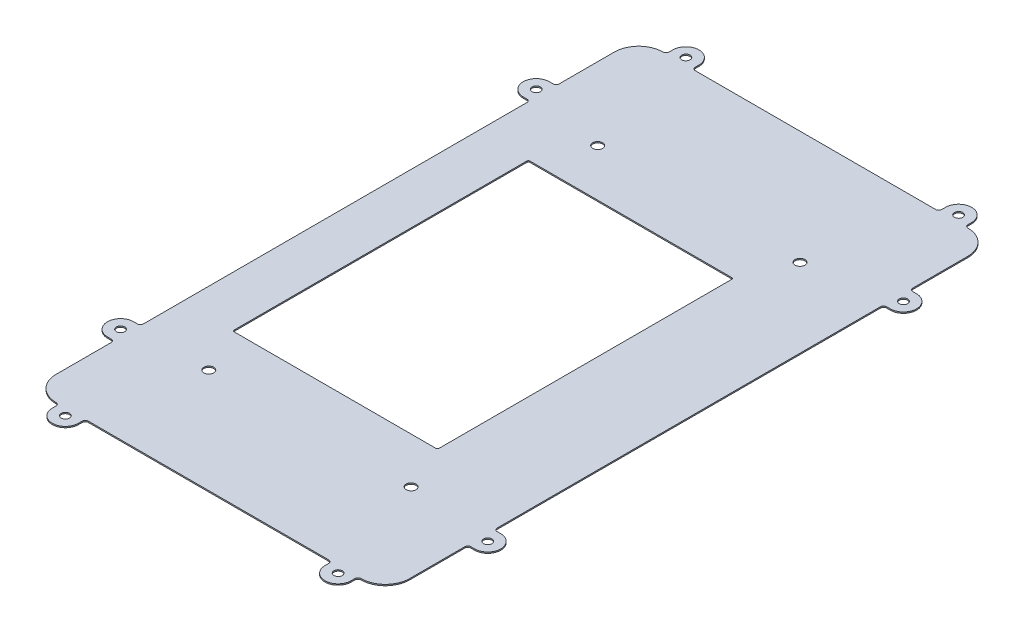
from build123d import *

# Parameters (mm, degrees)
BASE_DEPTH             = 16.1
SHELL_T                = -2
SCREEN_START           = 0.4
SCREEN_BASE_DEPTH      = 0.4
SKETCH21_R             = 1.6
LEG_HOLES_DEPTH        = 182.359773103
SCREEN_CLAMPS_DEPTH    = 0.4
SCREEN_CLAMP_FILLETS_R = 1
SKETCH23_R             = 1.35
CUT_EXTRUDE1_DEPTH     = 0.4
CUT_EXTRUDE2_DEPTH     = 191.280496373


with BuildPart() as part:
    # Sketch2 → Base (new body)
    with BuildSketch(Plane(origin=(0, 0, 0), x_dir=(1, 0, 0), z_dir=(0, 1, 0))):
        with BuildLine():
            Line((2.5, 0), (68, 0))
            ThreePointArc((68, 0), (69.767766953, 0.732233047), (70.5, 2.5))
            Line((70.5, 2.5), (70.5, 97.5))
            ThreePointArc((70.5, 97.5), (69.767766953, 99.267766953), (68, 100))
            Line((68, 100), (2.5, 100))
            ThreePointArc((2.5, 100), (0.732233047, 99.267766953), (0, 97.5))
            Line((0, 97.5), (0, 2.5))
            ThreePointArc((0, 2.5), (0.732233047, 0.732233047), (2.5, 0))
        make_face()
    extrude(amount=BASE_DEPTH)

    # Shell
    shell_openings = [part.faces().sort_by_distance(p)[0] for p in [
        (35.25, 16.1, -50),
        (35.25, 0, -50),
    ]]
    offset(amount=SHELL_T, openings=shell_openings, kind=Kind.INTERSECTION)

    # Sketch19 → Screen Base (add)
    with BuildSketch(Plane.XZ.offset(SCREEN_START)):
        with BuildLine():
            Line((-6.55, 46.74), (92.45, 46.74))
            ThreePointArc((92.45, 46.74), (98.022001436, 44.432001436), (100.33, 38.86))
            Line((100.33, 38.86), (100.33, -142.34))
            ThreePointArc((100.33, -142.34), (98.022001436, -147.912001436), (92.45, -150.22))
            Line((92.45, -150.22), (-6.55, -150.22))
            ThreePointArc((-6.55, -150.22), (-12.122001436, -147.912001436), (-14.43, -142.34))
            Line((-14.43, -142.34), (-14.43, 38.86))
            ThreePointArc((-14.43, 38.86), (-12.122001436, 44.432001436), (-6.55, 46.74))
        make_face()
        with BuildLine():
            Line((2.5, -98), (68, -98))
            ThreePointArc((68, -98), (68.353553391, -97.853553391), (68.5, -97.5))
            Line((68.5, -97.5), (68.5, -2.5))
            ThreePointArc((68.5, -2.5), (68.353553391, -2.146446609), (68, -2))
            Line((68, -2), (2.5, -2))
            ThreePointArc((2.5, -2), (2.146446609, -2.146446609), (2, -2.5))
            Line((2, -2.5), (2, -97.5))
            ThreePointArc((2, -97.5), (2.146446609, -97.853553391), (2.5, -98))
        make_face(mode=Mode.SUBTRACT)
    extrude(amount=-SCREEN_BASE_DEPTH)

    # Sketch21 → Leg Holes (cut, through all)
    with BuildSketch(Plane(origin=(0, 0, 0), x_dir=(1, 0, 0), z_dir=(0, 1, 0))):
        with Locations(Location((9.15, 113.35, 0), (0, 0, 270))):
            Circle(SKETCH21_R)
        with Locations(Location((74.8, 113.35, 0), (0, 0, 270))):
            Circle(SKETCH21_R)
        with Locations(Location((74.8, -12.85, 0), (0, 0, 270))):
            Circle(SKETCH21_R)
        with Locations(Location((9.15, -12.85, 0), (0, 0, 270))):
            Circle(SKETCH21_R)
    extrude(amount=-LEG_HOLES_DEPTH, mode=Mode.SUBTRACT)

    # Sketch22 → Screen Clamps (add)
    with BuildSketch(Plane(origin=(0, 0, 0), x_dir=(1, 0, 0), z_dir=(0, 1, 0))):
        with BuildLine():
            Line((-5.55, 152.42), (-5.55, 150.22))
            Line((-5.55, 150.22), (2.95, 150.22))
            Line((2.95, 150.22), (2.95, 152.42))
            ThreePointArc((2.95, 152.42), (-1.3, 156.67), (-5.55, 152.42))
        make_face()
        with BuildLine():
            Line((82.95, 152.42), (82.95, 150.22))
            Line((82.95, 150.22), (91.45, 150.22))
            Line((91.45, 150.22), (91.45, 152.42))
            ThreePointArc((91.45, 152.42), (87.2, 156.67), (82.95, 152.42))
        make_face()
        with BuildLine():
            Line((-5.55, -48.94), (-5.55, -46.74))
            Line((-5.55, -46.74), (2.95, -46.74))
            Line((2.95, -46.74), (2.95, -48.94))
            ThreePointArc((2.95, -48.94), (-1.3, -53.19), (-5.55, -48.94))
        make_face()
        with BuildLine():
            Line((82.95, -48.94), (82.95, -46.74))
            Line((82.95, -46.74), (91.45, -46.74))
            Line((91.45, -46.74), (91.45, -48.94))
            ThreePointArc((91.45, -48.94), (87.2, -53.19), (82.95, -48.94))
        make_face()
        with BuildLine():
            Line((-14.43, 123.44), (-16.63, 123.44))
            ThreePointArc((-16.63, 123.44), (-20.88, 119.19), (-16.63, 114.94))
            Line((-16.63, 114.94), (-14.43, 114.94))
            Line((-14.43, 114.94), (-14.43, 123.44))
        make_face()
        with BuildLine():
            Line((-14.43, -11.46), (-16.63, -11.46))
            ThreePointArc((-16.63, -11.46), (-20.88, -15.71), (-16.63, -19.96))
            Line((-16.63, -19.96), (-14.43, -19.96))
            Line((-14.43, -19.96), (-14.43, -11.46))
        make_face()
        with BuildLine():
            Line((100.33, -11.46), (102.53, -11.46))
            ThreePointArc((102.53, -11.46), (106.78, -15.71), (102.53, -19.96))
            Line((102.53, -19.96), (100.33, -19.96))
            Line((100.33, -19.96), (100.33, -11.46))
        make_face()
        with BuildLine():
            Line((100.33, 123.44), (102.53, 123.44))
            ThreePointArc((102.53, 123.44), (106.78, 119.19), (102.53, 114.94))
            Line((102.53, 114.94), (100.33, 114.94))
            Line((100.33, 114.94), (100.33, 123.44))
        make_face()
    extrude(amount=-SCREEN_CLAMPS_DEPTH)

    # Screen Clamp Fillets
    screen_clamp_fillets_edges = [part.edges().sort_by_distance(p)[0] for p in [
        (-5.55, -0.2, -150.22),
        (2.95, -0.2, -150.22),
        (82.95, -0.2, -150.22),
        (91.45, -0.2, -150.22),
        (2.95, -0.2, 46.74),
        (-5.55, -0.2, 46.74),
        (91.45, -0.2, 46.74),
        (82.95, -0.2, 46.74),
        (-14.43, -0.2, -114.94),
        (-14.43, -0.2, -123.44),
        (-14.43, -0.2, 19.96),
        (-14.43, -0.2, 11.46),
        (100.33, -0.2, 11.46),
        (100.33, -0.2, 19.96),
        (100.33, -0.2, -123.44),
        (100.33, -0.2, -114.94),
    ]]
    fillet(screen_clamp_fillets_edges, radius=SCREEN_CLAMP_FILLETS_R - 0.0001)  # a hair under: the kernel refuses the full size

    # Sketch23 → Cut-Extrude1 (cut)
    with BuildSketch(Plane(origin=(0, -0.4, 0), x_dir=(1, 0, 0), z_dir=(0, 1, 0))):
        with Locations(Location((-1.3, 152.42, 0), (0, 0, 90))):
            Circle(SKETCH23_R)
        with Locations(Location((87.2, 152.42, 0), (0, 0, 90))):
            Circle(SKETCH23_R)
        with Locations(Location((-1.3, -48.94, 0), (0, 0, 90))):
            Circle(SKETCH23_R)
        with Locations(Location((87.2, -48.94, 0), (0, 0, 90))):
            Circle(SKETCH23_R)
        with Locations(Location((-16.63, 119.19, 0), (0, 0, 90))):
            Circle(SKETCH23_R)
        with Locations(Location((102.53, 119.19, 0), (0, 0, 90))):
            Circle(SKETCH23_R)
        with Locations(Location((102.53, -15.71, 0), (0, 0, 90))):
            Circle(SKETCH23_R)
        with Locations(Location((-16.63, -15.71, 0), (0, 0, 90))):
            Circle(SKETCH23_R)
    extrude(amount=CUT_EXTRUDE1_DEPTH, mode=Mode.SUBTRACT)

    # Sketch24 → Cut-Extrude2 (cut, through all)
    with BuildSketch(Plane(origin=(0, 0, 0), x_dir=(1, 0, 0), z_dir=(0, 1, 0))):
        with BuildLine():
            Line((-16.63, 114.94), (-15.43, 114.94))
            ThreePointArc((-15.43, 114.94), (-14.722893219, 114.647106781), (-14.43, 113.94))
            Line((-14.43, 113.94), (-14.43, -10.46))
            ThreePointArc((-14.43, -10.46), (-14.722893219, -11.167106781), (-15.43, -11.46))
            Line((-15.43, -11.46), (-16.63, -11.46))
            ThreePointArc((-16.63, -11.46), (-20.88, -15.71), (-16.63, -19.96))
            Line((-16.63, -19.96), (-15.43, -19.96))
            ThreePointArc((-15.43, -19.96), (-14.722893219, -20.252893219), (-14.43, -20.96))
            Line((-14.43, -20.96), (-14.43, -38.86))
            ThreePointArc((-14.43, -38.86), (-12.122001436, -44.432001436), (-6.55, -46.74))
            ThreePointArc((-6.55, -46.74), (-5.842893219, -47.032893219), (-5.55, -47.74))
            Line((-5.55, -47.74), (-5.55, -48.94))
            ThreePointArc((-5.55, -48.94), (-1.3, -53.19), (2.95, -48.94))
            Line((2.95, -48.94), (2.95, -47.74))
            ThreePointArc((2.95, -47.74), (3.242893219, -47.032893219), (3.95, -46.74))
            Line((3.95, -46.74), (81.95, -46.74))
            ThreePointArc((81.95, -46.74), (82.657106781, -47.032893219), (82.95, -47.74))
            Line((82.95, -47.74), (82.95, -48.94))
            ThreePointArc((82.95, -48.94), (87.2, -53.19), (91.45, -48.94))
            Line((91.45, -48.94), (91.45, -47.74))
            ThreePointArc((91.45, -47.74), (91.742893219, -47.032893219), (92.45, -46.74))
            ThreePointArc((92.45, -46.74), (98.022001436, -44.432001436), (100.33, -38.86))
            Line((100.33, -38.86), (100.33, -20.96))
            ThreePointArc((100.33, -20.96), (100.622893219, -20.252893219), (101.33, -19.96))
            Line((101.33, -19.96), (102.53, -19.96))
            ThreePointArc((102.53, -19.96), (106.78, -15.71), (102.53, -11.46))
            Line((102.53, -11.46), (101.33, -11.46))
            ThreePointArc((101.33, -11.46), (100.622893219, -11.167106781), (100.33, -10.46))
            Line((100.33, -10.46), (100.33, 113.94))
            ThreePointArc((100.33, 113.94), (100.622893219, 114.647106781), (101.33, 114.94))
            Line((101.33, 114.94), (102.53, 114.94))
            ThreePointArc((102.53, 114.94), (106.78, 119.19), (102.53, 123.44))
            Line((102.53, 123.44), (101.33, 123.44))
            ThreePointArc((101.33, 123.44), (100.622893219, 123.732893219), (100.33, 124.44))
            Line((100.33, 124.44), (100.33, 142.34))
            ThreePointArc((100.33, 142.34), (98.022001436, 147.912001436), (92.45, 150.22))
            ThreePointArc((92.45, 150.22), (91.742893219, 150.512893219), (91.45, 151.22))
            Line((91.45, 151.22), (91.45, 152.42))
            ThreePointArc((91.45, 152.42), (87.2, 156.67), (82.95, 152.42))
            Line((82.95, 152.42), (82.95, 151.22))
            ThreePointArc((82.95, 151.22), (82.657106781, 150.512893219), (81.95, 150.22))
            Line((81.95, 150.22), (3.95, 150.22))
            ThreePointArc((3.95, 150.22), (3.242893219, 150.512893219), (2.95, 151.22))
            Line((2.95, 151.22), (2.95, 152.42))
            ThreePointArc((2.95, 152.42), (-1.3, 156.67), (-5.55, 152.42))
            Line((-5.55, 152.42), (-5.55, 151.22))
            ThreePointArc((-5.55, 151.22), (-5.842893219, 150.512893219), (-6.55, 150.22))
            ThreePointArc((-6.55, 150.22), (-12.122001436, 147.912001436), (-14.43, 142.34))
            Line((-14.43, 142.34), (-14.43, 124.44))
            ThreePointArc((-14.43, 124.44), (-14.722893219, 123.732893219), (-15.43, 123.44))
            Line((-15.43, 123.44), (-16.63, 123.44))
            ThreePointArc((-16.63, 123.44), (-20.88, 119.19), (-16.63, 114.94))
        make_face()
    extrude(amount=CUT_EXTRUDE2_DEPTH, mode=Mode.SUBTRACT)


solid = part.part
